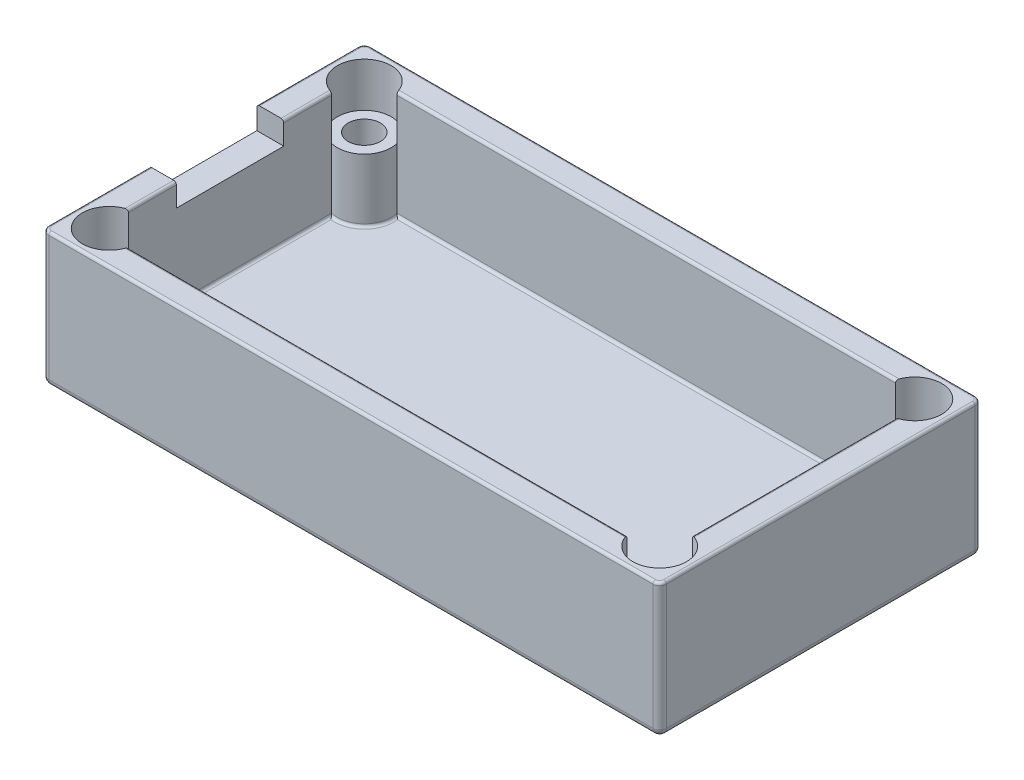
from build123d import *

# Parameters (mm, degrees)
SKETCH_1_W          = 23
SKETCH_1_H          = 12
EXTRUDE_1_DEPTH     = 5
SHELL_1_T           = -1
FILLET_1_R          = 0.25
FILLET_2_R          = 0.1
SKETCH_1_3_R        = 1
CUT_EXTRUDE_1_DEPTH = 14.901438774
EXTRUDE_START       = 0.85
SKETCH_1_4_R        = 1
SKETCH_1_4_R_2      = 0.6
EXTRUDE_1_2_DEPTH   = 2.5
SKETCH_3_W          = 4
SKETCH_3_H          = 1.5
CUT_EXTRUDE_2_DEPTH = 2.5
FILLET_3_R          = 0.1


with BuildPart() as part:
    # 草图1 → Extrude 1 (new body)
    with BuildSketch(Plane(origin=(0, 0, 0), x_dir=(1, 0, 0), z_dir=(0, 1, 0))):
        Rectangle(SKETCH_1_W, SKETCH_1_H)
    extrude(amount=EXTRUDE_1_DEPTH)

    # 抽壳1
    shell_1_openings = [part.faces().sort_by_distance(p)[0] for p in [
        (0, 5, 0),
    ]]
    offset(amount=SHELL_1_T, openings=shell_1_openings, kind=Kind.INTERSECTION)

    # 圆角1
    fillet_1_edges = [part.edges().sort_by_distance(p)[0] for p in [
        (0, 0, 6),
        (11.5, 0, 0),
        (0, 0, -6),
        (-11.5, 0, 0),
        (11.5, 2.5, 6),
        (11.5, 2.5, -6),
        (-11.5, 2.5, -6),
        (-11.5, 2.5, 6),
    ]]
    fillet(fillet_1_edges, radius=FILLET_1_R)

    # 圆角2
    fillet_2_edges = [part.edges().sort_by_distance(p)[0] for p in [
        (-11.426776695, 5, 5.926776695),
        (-11.5, 5, 0),
        (-11.426776695, 5, -5.926776695),
        (0, 5, -6),
        (11.426776695, 5, -5.926776695),
        (11.5, 5, 0),
        (11.426776695, 5, 5.926776695),
        (0, 5, 6),
        (0, 5, 5),
        (10.5, 5, 0),
        (0, 5, -5),
        (-10.5, 5, 0),
    ]]
    fillet(fillet_2_edges, radius=FILLET_2_R)

    # 草图1<3> → 切除-拉伸1 (cut, through all)
    with BuildSketch(Plane(origin=(0, 0, 0), x_dir=(1, 0, 0), z_dir=(0, 1, 0))):
        with Locations((-10.25, -4.75)):
            Circle(SKETCH_1_3_R)
        with Locations((-10.25, 4.75)):
            Circle(SKETCH_1_3_R)
        with Locations((10.25, -4.75)):
            Circle(SKETCH_1_3_R)
        with Locations((10.25, 4.75)):
            Circle(SKETCH_1_3_R)
    extrude(amount=CUT_EXTRUDE_1_DEPTH, mode=Mode.SUBTRACT)

    # 草图1<4> → Extrude 1 2 (add)
    # profile 1 of 4: a face of its own
    with BuildSketch(Plane(origin=(0, 0, 0), x_dir=(1, 0, 0), z_dir=(0, 1, 0)).offset(EXTRUDE_START)):
        with Locations((-10.25, -4.75)):
            Circle(SKETCH_1_4_R)
        with Locations((-10.25, -4.75)):
            Circle(SKETCH_1_4_R_2, mode=Mode.SUBTRACT)
    # profile 2 of 4: a face of its own
    with BuildSketch(Plane(origin=(0, 0, 0), x_dir=(1, 0, 0), z_dir=(0, 1, 0)).offset(EXTRUDE_START)):
        with Locations((-10.25, 4.75)):
            Circle(SKETCH_1_4_R)
        with Locations((-10.25, 4.75)):
            Circle(SKETCH_1_4_R_2, mode=Mode.SUBTRACT)
    # profile 3 of 4: a face of its own
    with BuildSketch(Plane(origin=(0, 0, 0), x_dir=(1, 0, 0), z_dir=(0, 1, 0)).offset(EXTRUDE_START)):
        with Locations((10.25, -4.75)):
            Circle(SKETCH_1_4_R)
        with Locations((10.25, -4.75)):
            Circle(SKETCH_1_4_R_2, mode=Mode.SUBTRACT)
    # profile 4 of 4: a face of its own
    with BuildSketch(Plane(origin=(0, 0, 0), x_dir=(1, 0, 0), z_dir=(0, 1, 0)).offset(EXTRUDE_START)):
        with Locations((10.25, 4.75)):
            Circle(SKETCH_1_4_R)
        with Locations((10.25, 4.75)):
            Circle(SKETCH_1_4_R_2, mode=Mode.SUBTRACT)
    extrude(amount=EXTRUDE_1_2_DEPTH)

    # 草图3 → 切除-拉伸2 (cut)
    with BuildSketch(Plane.ZY.offset(11.5)):
        with Locations((0, 4.9)):
            Rectangle(SKETCH_3_W, SKETCH_3_H)
    extrude(amount=-CUT_EXTRUDE_2_DEPTH, mode=Mode.SUBTRACT)

    # 圆角3
    fillet_3_edges = [part.edges().sort_by_distance(p)[0] for p in [
        (-9.542893219, 1, -4.042893219),
        (0, 1, -5),
        (9.542893219, 1, -4.042893219),
        (10.5, 1, 0),
        (9.542893219, 1, 4.042893219),
        (0, 1, 5),
        (-9.542893219, 1, 4.042893219),
        (-10.5, 1, 0),
    ]]
    fillet(fillet_3_edges, radius=FILLET_3_R)


solid = part.part
